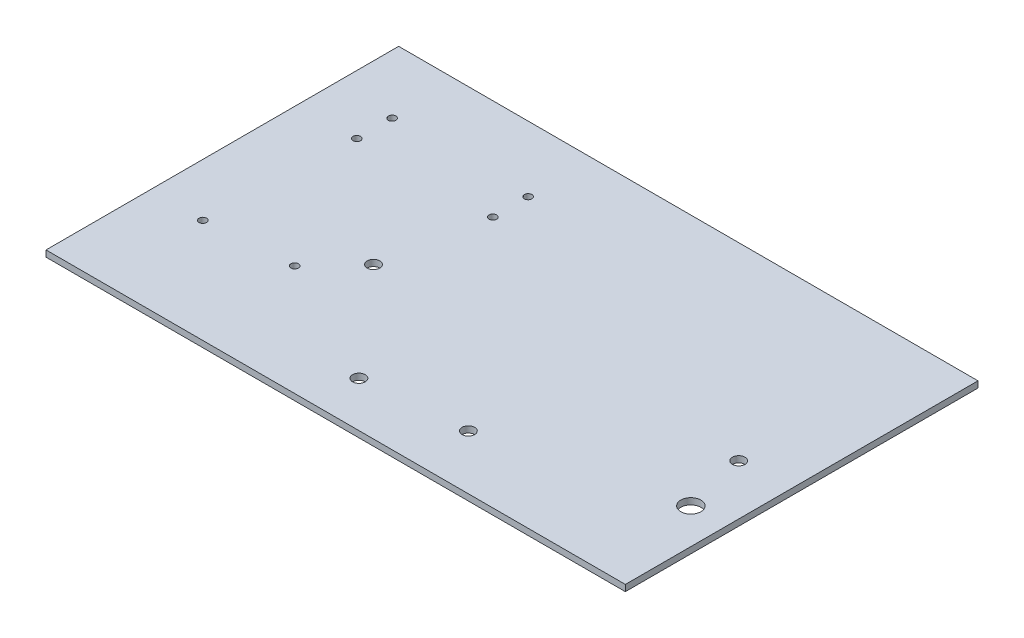
from build123d import *

# Parameters (mm, degrees)
SKETCH1_W           = 317.5
SKETCH1_H           = 177.8
SKETCH1_R           = 3.175
SKETCH1_R_2         = 1.905
BOSS_EXTRUDE1_DEPTH = 3.175
SKETCH2_R           = 1.905
CUT_EXTRUDE1_DEPTH  = 182.974869488
SKETCH3_R           = 3.175
CUT_EXTRUDE2_DEPTH  = 182.974869488
SKETCH4_W           = 25.4
SKETCH4_H           = 177.8
CUT_EXTRUDE3_DEPTH  = 182.974869488
SKETCH5_R           = 5.08
CUT_EXTRUDE4_DEPTH  = 182.974869488


with BuildPart() as part:
    # Sketch1 → Boss-Extrude1 (new body)
    with BuildSketch(Plane(origin=(0, 0, 0), x_dir=(1, 0, 0), z_dir=(0, 1, 0))):
        Rectangle(SKETCH1_W, SKETCH1_H)
        with Locations((-69.85, -12.7)):
            Circle(SKETCH1_R, mode=Mode.SUBTRACT)
        with Locations((107.95, -6.35)):
            Circle(SKETCH1_R, mode=Mode.SUBTRACT)
        with Locations((-129.032, 55.88)):
            Circle(SKETCH1_R_2, mode=Mode.SUBTRACT)
        with Locations((-60.452, 55.88)):
            Circle(SKETCH1_R_2, mode=Mode.SUBTRACT)
        with Locations((-129.032, 38.1)):
            Circle(SKETCH1_R_2, mode=Mode.SUBTRACT)
        with Locations((-60.452, 38.1)):
            Circle(SKETCH1_R_2, mode=Mode.SUBTRACT)
    extrude(amount=BOSS_EXTRUDE1_DEPTH)

    # Sketch2 → Cut-Extrude1 (cut, through all)
    with BuildSketch(Plane(origin=(0, 3.175, 0), x_dir=(1, 0, 0), z_dir=(0, 1, 0))):
        with Locations((-89.08170041, -33.177029855)):
            Circle(SKETCH2_R)
        with Locations((-132.137607944, -36.44830276)):
            Circle(SKETCH2_R)
    extrude(amount=-CUT_EXTRUDE1_DEPTH, mode=Mode.SUBTRACT)

    # Sketch3 → Cut-Extrude2 (cut, through all)
    with BuildSketch(Plane(origin=(0, 0, 0), x_dir=(-1, 0, 0), z_dir=(0, -1, 0))):
        with Locations((23.829539609, -66.04)):
            Circle(SKETCH3_R)
        with Locations((-26.764302072, -61.468)):
            Circle(SKETCH3_R)
    extrude(amount=-CUT_EXTRUDE2_DEPTH, mode=Mode.SUBTRACT)

    # Sketch4 → Cut-Extrude3 (cut, through all)
    with BuildSketch(Plane(origin=(0, 3.175, 0), x_dir=(1, 0, 0), z_dir=(0, 1, 0))):
        with Locations((146.05, 0)):
            Rectangle(SKETCH4_W, SKETCH4_H)
    extrude(amount=-CUT_EXTRUDE3_DEPTH, mode=Mode.SUBTRACT)

    # Sketch5 → Cut-Extrude4 (cut, through all)
    with BuildSketch(Plane(origin=(0, 3.175, 0), x_dir=(1, 0, 0), z_dir=(0, 1, 0))):
        with Locations((115.57, -38.1)):
            Circle(SKETCH5_R)
    extrude(amount=-CUT_EXTRUDE4_DEPTH, mode=Mode.SUBTRACT)


solid = part.part
